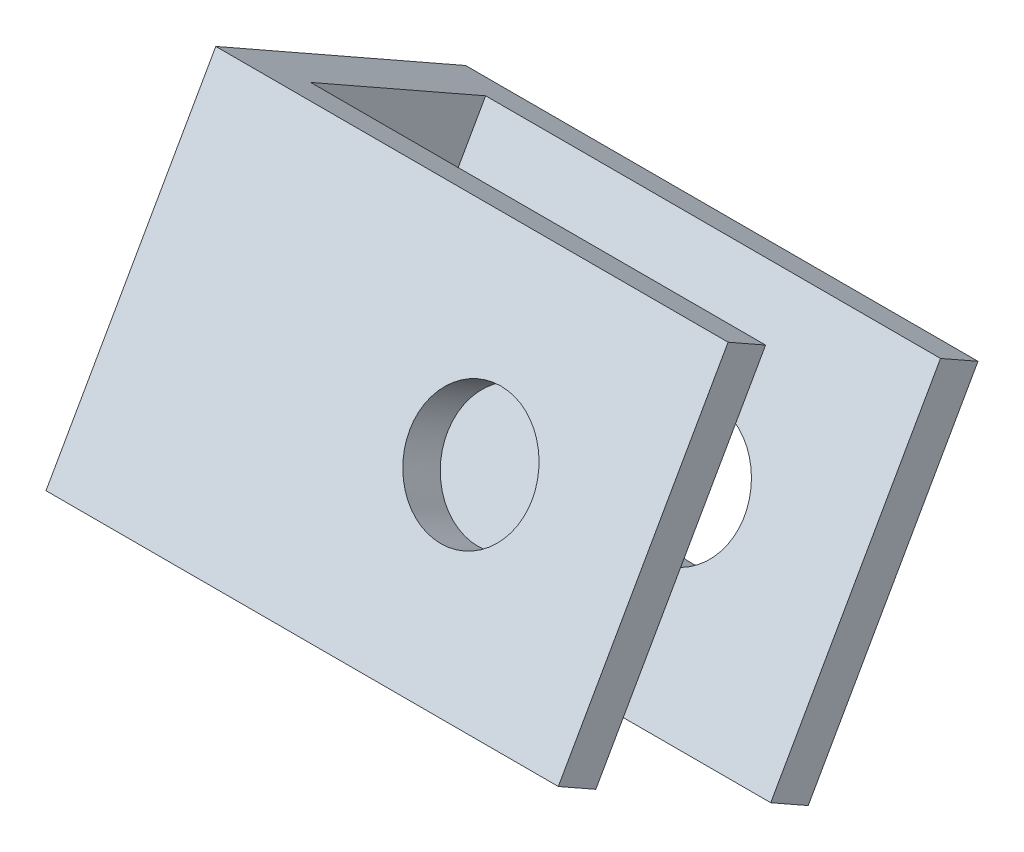
from build123d import *

# Parameters (mm, degrees)
SKETCH1_W           = 28.321
SKETCH1_H           = 19.05
SKETCH1_R           = 3.3782
BOSS_EXTRUDE1_DEPTH = 7.9375
SKETCH2_W           = 31.794417924
SKETCH2_H           = 11.1125
CUT_EXTRUDE1_DEPTH  = 670.195014149
SKETCH3_R           = 2.5527
CUT_EXTRUDE2_DEPTH  = 1371.562973476


with BuildPart() as part:
    # Sketch1 → Boss-Extrude1 (new, symmetric)
    with BuildSketch(Plane(origin=(0, -217.945214779, -384.948202745), x_dir=(-1, 0, 0), z_dir=(0, -0.4926838295770631, -0.8702083911760905))):
        with Locations((473.289499952, 1279.170858512)):
            Rectangle(SKETCH1_W, SKETCH1_H)
        with Locations((468.653999952, 1279.170858512)):
            Circle(SKETCH1_R, mode=Mode.SUBTRACT)
    extrude(amount=BOSS_EXTRUDE1_DEPTH, both=True)

    # Sketch2 → Cut-Extrude1 (cut, through all)
    with BuildSketch(Plane(origin=(0, 1104.856479899, -625.533983778), x_dir=(1, 0, 0), z_dir=(0, -0.8702083911760903, 0.49268382957706325))):
        with Locations((-468.37779099, -442.363239252)):
            Rectangle(SKETCH2_W, SKETCH2_H)
    extrude(amount=-CUT_EXTRUDE1_DEPTH, mode=Mode.SUBTRACT)

    # Sketch3 → Cut-Extrude2 (cut, through all)
    with BuildSketch(Plane.ZY.offset(487.449999952)):
        with Locations((-1015.175, 895.200000046)):
            Circle(SKETCH3_R)
    extrude(amount=-CUT_EXTRUDE2_DEPTH, mode=Mode.SUBTRACT)


solid = part.part
